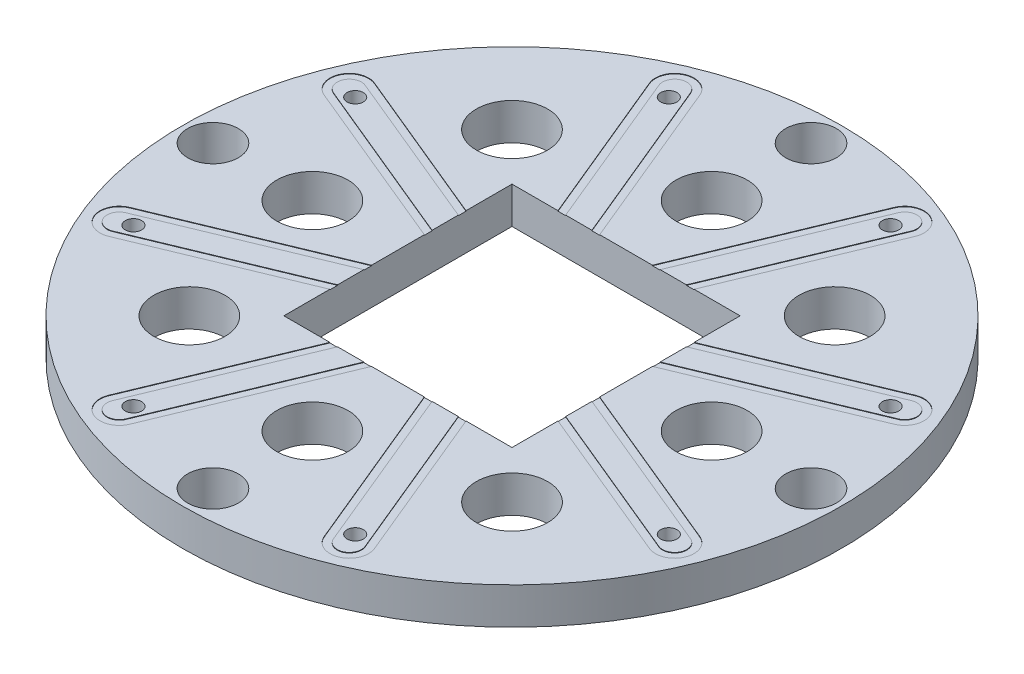
from build123d import *

# Parameters (mm, degrees)
BODAY_SKETCH_R        = 11.557
BODY_DEPTH            = 1.27
COPPER_START          = 0.017500092
COPPER_SKETCH_R       = 11.557
COPPER_DEPTH          = 0.017500092
F_0_CLEARANCE_HOLE1_D = 1.778
SCREW_HOLES_COUNT     = 4
GAP_CUT_DEPTH         = 17.39333395
CENTER_DEPTH          = 0.017500092
IO_HOLE_SKETCH_R      = 0.287000061
IO_HOLE_DEPTH         = 17.39333395
GAP_CUTS_COUNT        = 8
CENTERS_COUNT         = 8
IO_HOLES_COUNT        = 8
POCKET_DEPTH          = 17.39333395
POCKET_DEPTH_BACK     = 17.39333395
POCKET_SKETCH_W       = 8.000000002
POCKET_SKETCH_H       = 8.000000002
POSTS_R               = 1.25000004
POST_CUT_DEPTH        = 17.39333395
POST_CUTS_COUNT       = 4


with BuildPart() as part:
    # Boday Sketch → Body (new body)
    with BuildSketch(Plane(origin=(0, 0, 0), x_dir=(1, 0, 0), z_dir=(0, 1, 0))):
        Circle(BODAY_SKETCH_R)
    extrude(amount=-BODY_DEPTH)

    # Copper Sketch → Copper (add)
    with BuildSketch(Plane(origin=(0, 0, 0), x_dir=(1, 0, 0), z_dir=(0, 1, 0)).offset(COPPER_START)):
        Circle(COPPER_SKETCH_R)
    extrude(amount=-COPPER_DEPTH)

    # #0 Clearance Hole1 (through all)
    with Locations(Plane(origin=(0, 0.017500092, 0), x_dir=(-1, 0, 0), z_dir=(0, 1, 0))):
        with Locations((0, -10.486549711)):
            f_0_clearance_hole1 = Hole(F_0_CLEARANCE_HOLE1_D / 2)

    # Screw Holes: #0 Clearance Hole1 ×4 about axis
    screw_holes_axis = Axis((0, 0.0762, 0), (0, -1, 0))
    for i in range(1, SCREW_HOLES_COUNT):
        add(f_0_clearance_hole1.rotate(screw_holes_axis, i * 360 / SCREW_HOLES_COUNT), mode=Mode.SUBTRACT)

    # Gap → Gap Cut (cut, through all)
    with BuildSketch(Plane(origin=(0, 0, 0), x_dir=(1, 0, 0), z_dir=(0, 1, 0))):
        with BuildLine():
            Line((0.623618728, 0.258311335), (-3.410247333, 9.996925487))
            ThreePointArc((-3.410247333, 9.996925487), (-4.292177395, 10.36223288), (-4.657484788, 9.480302817))
            Line((-4.657484788, 9.480302817), (-0.623618728, -0.258311335))
            Line((-0.623618728, -0.258311335), (0.623618728, 0.258311335))
        make_face()
    gap_cut = extrude(amount=GAP_CUT_DEPTH, mode=Mode.SUBTRACT)


with BuildPart() as body_2:
    # Center Sketch → Center (new body)
    with BuildSketch(Plane(origin=(0, 0, 0), x_dir=(1, 0, 0), z_dir=(0, 1, 0))):
        with BuildLine():
            Line((0.392648837, 0.162640474), (-3.641217223, 9.901254626))
            ThreePointArc((-3.641217223, 9.901254626), (-4.196506534, 10.13126299), (-4.426514898, 9.575973679))
            Line((-4.426514898, 9.575973679), (-0.392648837, -0.162640474))
            Line((-0.392648837, -0.162640474), (0.392648837, 0.162640474))
        make_face()
    center = extrude(amount=CENTER_DEPTH)


with BuildPart() as io_hole_tool:
    # IO Hole Sketch → IO Hole (new, symmetric)
    with BuildSketch(Plane(origin=(0, 0, 0), x_dir=(1, 0, 0), z_dir=(0, 1, 0))):
        with Locations((-3.888063673, 9.38661605)):
            Circle(IO_HOLE_SKETCH_R)
    io_hole = extrude(amount=IO_HOLE_DEPTH, both=True)


with BuildPart() as part_1:
    add(part.part)

    # IO Hole: cut by io_hole_tool
    add(io_hole_tool.part, mode=Mode.SUBTRACT)

    # Gap Cuts: Gap Cut ×8 about axis
    gap_cuts_axis = Axis((0, 0.0762, 0), (0, -1, 0))
    for i in range(1, GAP_CUTS_COUNT):
        add(gap_cut.rotate(gap_cuts_axis, i * 360 / GAP_CUTS_COUNT), mode=Mode.SUBTRACT)



with BuildPart() as body_2_1:
    add(body_2.part)

    # IO Hole: cut by io_hole_tool
    add(io_hole_tool.part, mode=Mode.SUBTRACT)


with BuildPart() as part_2:
    add(part_1.part)

    add(body_2_1.part)  # Centers merges body 2
    # Centers: Center ×8 about axis
    centers_axis = Axis((0, 0.0762, 0), (0, -1, 0))
    for i in range(1, CENTERS_COUNT):
        add(center.rotate(centers_axis, i * 360 / CENTERS_COUNT))

    # IO Holes: IO Hole ×8 about axis
    io_holes_axis = Axis((0, 0.0762, 0), (0, -1, 0))
    for i in range(1, IO_HOLES_COUNT):
        add(io_hole.rotate(io_holes_axis, i * 360 / IO_HOLES_COUNT), mode=Mode.SUBTRACT)

    # Pocket Sketch → Pocket (cut, two sides: drawn at the far end of the back side and taken through both)
    with BuildSketch(Plane(origin=(0, 0, 0), x_dir=(1, 0, 0), z_dir=(0, 1, 0)).offset(-POCKET_DEPTH_BACK)):
        Rectangle(POCKET_SKETCH_W, POCKET_SKETCH_H)
    extrude(amount=POCKET_DEPTH + POCKET_DEPTH_BACK, mode=Mode.SUBTRACT)

    # Posts → Post Cut (cut, symmetric)
    with BuildSketch(Plane(origin=(0, 0, 0), x_dir=(1, 0, 0), z_dir=(0, 1, 0))):
        with Locations((0, 6.99999997)):
            Circle(POSTS_R)
        with Locations((-5.656854251, 5.656854251)):
            Circle(POSTS_R)
    post_cut = extrude(amount=POST_CUT_DEPTH, both=True, mode=Mode.SUBTRACT)

    # Post Cuts: Post Cut ×4 about axis
    post_cuts_axis = Axis((0, 0.0762, 0), (0, -1, 0))
    for i in range(1, POST_CUTS_COUNT):
        add(post_cut.rotate(post_cuts_axis, i * 360 / POST_CUTS_COUNT), mode=Mode.SUBTRACT)


solid = part_2.part
